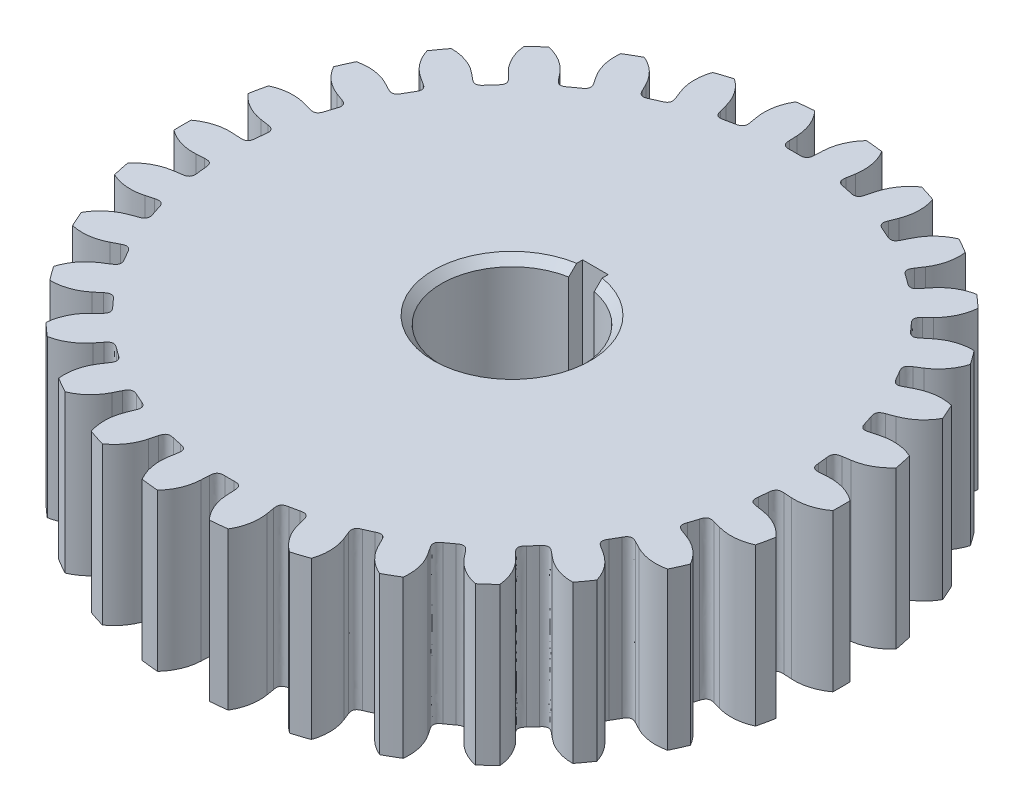
from build123d import *

# Parameters (mm, degrees)
BOSS_EXTRUDE1_DEPTH = 10
CIRPATTERN3_COUNT   = 30
CUT_EXTRUDE3_DEPTH  = 63.58706845
CHAMFER1_SIZE       = 1


with BuildPart() as part:
    # Sketch5 → Boss-Extrude1 (new, symmetric)
    with BuildSketch(Plane(origin=(0, 0, 0), x_dir=(1, 0, 0), z_dir=(0, 1, 0))):
        with BuildLine():
            Line((0, 0), (35.802788233, 3.763024678))
            ThreePointArc((35.802788233, 3.763024678), (35.87635809, 2.98109547), (35.932852743, 2.197747423))
            Line((35.932852743, 2.197747423), (37.92912234, 2.319844502))
            ThreePointArc((37.92912234, 2.319844502), (40.066301936, 2.071729703), (41.985607649, 1.099431829))
            ThreePointArc((41.985607649, 1.099431829), (42, 0), (41.985607649, -1.099431829))
            ThreePointArc((41.985607649, -1.099431829), (40.066301936, -2.071729703), (37.92912234, -2.319844502))
            Line((37.92912234, -2.319844502), (35.932852743, -2.197747423))
            ThreePointArc((35.932852743, -2.197747423), (35.87635809, -2.98109547), (35.802788233, -3.763024678))
            Line((35.802788233, -3.763024678), (0, 0))
        make_face()
    boss_extrude1 = extrude(amount=BOSS_EXTRUDE1_DEPTH, both=True)

    # Fillet3
    # a fillet whose section is not a circle: 1 mm, written as the material it adds along each edge
    with BuildSketch(Plane(origin=(35.932852743, 10, -2.197747423), x_dir=(0.9981347984218669, 0, -0.06104853953485661), z_dir=(0, -1, 0)), Plane(origin=(35.932852743, -10, 2.197747423), x_dir=(0.998134798421867, 0, 0.061048539534856595), z_dir=(0, 1, 0))) as fillet3_piece_1:
        with BuildLine():
            add(Edge.make_bspline([(0.986484018, 0), (0.822062706, 0), (0.657641394, 0), (0.294804365, -0.06865127), (0.074169551, -0.283401428), (-0.004263047, -0.644250474), (-0.008706866, -0.808611724), (-0.013150685, -0.972972973)], knots=[0, 0, 0, 0, 0, 0, 0.5, 0.5, 1, 1, 1, 1, 1, 1], degree=5))
            ThreePointArc((-0.013150685, -0.972972973), (-0.003287821, -0.486530921), (0, 0))
            Line((0, 0), (0.986484018, 0))
        make_face()
    extrude(amount=20)

    # CirPattern3: Boss-Extrude1 ×30 about axis
    cirpattern3_axis = Axis((0, 10, 0), (0, -1, 0))
    for i in range(1, CIRPATTERN3_COUNT):
        add(boss_extrude1.rotate(cirpattern3_axis, i * 360 / CIRPATTERN3_COUNT))

    # Fillet3 of CirPattern3
    # a fillet whose section is not a circle: 1 mm, written as the material it adds along each edge
    with BuildSketch(Plane(origin=(35.604571081, 10, 5.321138801), x_dir=(0.13442961197931483, 0, -0.9909231450637789), z_dir=(0, -1, 0)), Plane(origin=(33.720198813, 10, 12.607465725), x_dir=(0.3375165089858118, 0, -0.941319608933135), z_dir=(0, -1, 0)), Plane(origin=(30.362092049, 10, 19.3427859), x_dir=(0.5258523149657179, 0, -0.8505758889394852), z_dir=(0, -1, 0)), Plane(origin=(25.67701617, 10, 25.232733515), x_dir=(0.6912058514622661, 0, -0.7226579210832216), z_dir=(0, -1, 0)), Plane(origin=(19.869731471, 10, 30.019889594), x_dir=(0.8263503754762392, 0, -0.5631563343781889), z_dir=(0, -1, 0)), Plane(origin=(13.194044162, 10, 33.495032447), x_dir=(0.9253794228128641, 0, -0.3790421135369137), z_dir=(0, -1, 0)), Plane(origin=(5.941713811, 10, 35.506281655), x_dir=(0.9839649489094336, 0, -0.17836193348821816), z_dir=(0, -1, 0)), Plane(origin=(-1.570297945, 10, 35.965735977), x_dir=(0.999546485150984, 0, 0.030113518929438858), z_dir=(0, -1, 0)), Plane(origin=(-9.013680146, 10, 34.853315054), x_dir=(0.9714430436352546, 0, 0.237272866069159), z_dir=(0, -1, 0)), Plane(origin=(-16.063121272, 10, 32.217637018), x_dir=(0.9008828796117487, 0, 0.43406225040015106), z_dir=(0, -1, 0)), Plane(origin=(-22.410526919, 10, 28.173893647), x_dir=(0.790949810833542, 0, 0.6118810315268681), z_dir=(0, -1, 0)), Plane(origin=(-27.778485002, 10, 22.89881593), x_dir=(0.6464484399236214, 0, 0.76295767544492), z_dir=(0, -1, 0)), Plane(origin=(-31.932389994, 10, 16.622950076), x_dir=(0.47369417018526017, 0, 0.8806894078689137), z_dir=(0, -1, 0)), Plane(origin=(-34.690696316, 10, 9.620581539), x_dir=(0.28023719217299753, 0, 0.9599307871523834), z_dir=(0, -1, 0)), Plane(origin=(-35.932852743, 10, 2.197747423), x_dir=(0.07453250413551762, 0, 0.9972185847783269), z_dir=(0, -1, 0)), Plane(origin=(-35.604571081, 10, -5.321138801), x_dir=(-0.1344296119793113, 0, 0.9909231450637793), z_dir=(0, -1, 0)), Plane(origin=(-33.720198813, 10, -12.607465725), x_dir=(-0.3375165089858262, 0, 0.9413196089331299), z_dir=(0, -1, 0)), Plane(origin=(-30.362092049, 10, -19.3427859), x_dir=(-0.5258523149657195, 0, 0.8505758889394842), z_dir=(0, -1, 0)), Plane(origin=(-25.67701617, 10, -25.232733515), x_dir=(-0.6912058514622605, 0, 0.7226579210832269), z_dir=(0, -1, 0)), Plane(origin=(-19.869731471, 10, -30.019889594), x_dir=(-0.8263503754762364, 0, 0.563156334378193), z_dir=(0, -1, 0)), Plane(origin=(-13.194044162, 10, -33.495032447), x_dir=(-0.9253794228128651, 0, 0.3790421135369113), z_dir=(0, -1, 0)), Plane(origin=(-5.941713811, 10, -35.506281655), x_dir=(-0.9839649489094324, 0, 0.17836193348822474), z_dir=(0, -1, 0)), Plane(origin=(1.570297945, 10, -35.965735977), x_dir=(-0.9995464851509842, 0, -0.030113518929431548), z_dir=(0, -1, 0)), Plane(origin=(9.013680146, 10, -34.853315054), x_dir=(-0.9714430436352549, 0, -0.23727286606915732), z_dir=(0, -1, 0)), Plane(origin=(16.063121272, 10, -32.217637018), x_dir=(-0.900882879611752, 0, -0.43406225040014446), z_dir=(0, -1, 0)), Plane(origin=(22.410526919, 10, -28.173893647), x_dir=(-0.7909498108335425, 0, -0.6118810315268675), z_dir=(0, -1, 0)), Plane(origin=(27.778485002, 10, -22.89881593), x_dir=(-0.6464484399236218, 0, -0.7629576754449198), z_dir=(0, -1, 0)), Plane(origin=(31.932389994, 10, -16.622950076), x_dir=(-0.4736941701852644, 0, -0.8806894078689115), z_dir=(0, -1, 0)), Plane(origin=(34.690696316, 10, -9.620581539), x_dir=(-0.2802371921729893, 0, -0.9599307871523859), z_dir=(0, -1, 0))) as fillet3_of_cirpattern3_piece_1:
        with BuildLine():
            add(Edge.make_bspline([(0.973061841, 0), (0.808655546, 0.002222113), (0.64424925, 0.004444225), (0.282373163, 0.077992876), (0.064660793, 0.295705245), (-0.008887858, 0.657581333), (-0.01110997, 0.821987628), (-0.013332083, 0.986393924)], knots=[0, 0, 0, 0, 0, 0, 0.5, 0.5, 1, 1, 1, 1, 1, 1], degree=5))
            Line((-0.013332083, 0.986393924), (0, 0))
            ThreePointArc((0, 0), (0.486530921, 0.003287821), (0.973061841, 0))
        make_face()
    extrude(amount=20)
    with BuildSketch(Plane(origin=(34.690696316, -10, 9.620581539), x_dir=(0.9636304532086233, 0, 0.26723837607825607), z_dir=(0, 1, 0)), Plane(origin=(31.932389994, -10, 16.622950076), x_dir=(0.8870108331782218, 0, 0.4617486132350335), z_dir=(0, 1, 0)), Plane(origin=(27.778485002, -10, 22.89881593), x_dir=(0.7716245833877204, 0, 0.6360782202777634), z_dir=(0, 1, 0)), Plane(origin=(22.410526919, -10, 28.173893647), x_dir=(0.622514636637622, 0, 0.782608156852412), z_dir=(0, 1, 0)), Plane(origin=(16.063121272, -10, 32.217637018), x_dir=(0.4461978131098116, 0, 0.8949343616020237), z_dir=(0, 1, 0)), Plane(origin=(9.013680146, -10, 34.853315054), x_dir=(0.25038000405444055, 0, 0.968147640378108), z_dir=(0, 1, 0)), Plane(origin=(1.570297945, -10, 35.965735977), x_dir=(0.04361938736533595, 0, 0.9990482215818578), z_dir=(0, 1, 0)), Plane(origin=(-5.941713811, -10, 35.506281655), x_dir=(-0.1650476058606768, 0, 0.9862856015372315), z_dir=(0, 1, 0)), Plane(origin=(-13.194044162, -10, 33.495032447), x_dir=(-0.36650122672429636, 0, 0.9304175679820249), z_dir=(0, 1, 0)), Plane(origin=(-19.869731471, -10, 30.019889594), x_dir=(-0.551936985312057, 0, 0.8338858220671689), z_dir=(0, 1, 0)), Plane(origin=(-25.67701617, -10, 25.232733515), x_dir=(-0.7132504491541812, 0, 0.7009092642998512), z_dir=(0, 1, 0)), Plane(origin=(-30.362092049, -10, 19.3427859), x_dir=(-0.8433914458128878, 0, 0.5372996083468207), z_dir=(0, 1, 0)), Plane(origin=(-33.720198813, -10, 12.607465725), x_dir=(-0.9366721892483983, 0, 0.3502073812594656), z_dir=(0, 1, 0)), Plane(origin=(-35.604571081, -10, 5.321138801), x_dir=(-0.9890158633619168, 0, 0.14780941112961135), z_dir=(0, 1, 0)), Plane(origin=(-35.932852743, -10, -2.197747423), x_dir=(-0.9981347984218669, 0, -0.06104853953485703), z_dir=(0, 1, 0)), Plane(origin=(-34.690696316, -10, -9.620581539), x_dir=(-0.9636304532086231, 0, -0.2672383760782569), z_dir=(0, 1, 0)), Plane(origin=(-31.932389994, -10, -16.622950076), x_dir=(-0.8870108331782237, 0, -0.46174861323502997), z_dir=(0, 1, 0)), Plane(origin=(-27.778485002, -10, -22.89881593), x_dir=(-0.7716245833877183, 0, -0.636078220277766), z_dir=(0, 1, 0)), Plane(origin=(-22.410526919, -10, -28.173893647), x_dir=(-0.6225146366376192, 0, -0.7826081568524141), z_dir=(0, 1, 0)), Plane(origin=(-16.063121272, -10, -32.217637018), x_dir=(-0.44619781310981443, 0, -0.8949343616020221), z_dir=(0, 1, 0)), Plane(origin=(-9.013680146, -10, -34.853315054), x_dir=(-0.25038000405444055, 0, -0.968147640378108), z_dir=(0, 1, 0)), Plane(origin=(-1.570297945, -10, -35.965735977), x_dir=(-0.04361938736533604, 0, -0.9990482215818578), z_dir=(0, 1, 0)), Plane(origin=(5.941713811, -10, -35.506281655), x_dir=(0.1650476058606768, 0, -0.9862856015372315), z_dir=(0, 1, 0)), Plane(origin=(13.194044162, -10, -33.495032447), x_dir=(0.366501226724297, 0, -0.9304175679820247), z_dir=(0, 1, 0)), Plane(origin=(19.869731471, -10, -30.019889594), x_dir=(0.551936985312061, 0, -0.8338858220671663), z_dir=(0, 1, 0)), Plane(origin=(25.67701617, -10, -25.232733515), x_dir=(0.7132504491541795, 0, -0.7009092642998531), z_dir=(0, 1, 0)), Plane(origin=(30.362092049, -10, -19.3427859), x_dir=(0.8433914458128867, 0, -0.5372996083468223), z_dir=(0, 1, 0)), Plane(origin=(33.720198813, -10, -12.607465725), x_dir=(0.9366721892483983, 0, -0.3502073812594656), z_dir=(0, 1, 0)), Plane(origin=(35.604571081, -10, -5.321138801), x_dir=(0.9890158633619165, 0, -0.14780941112961246), z_dir=(0, 1, 0))) as fillet3_of_cirpattern3_piece_2:
        with BuildLine():
            add(Edge.make_bspline([(0.986484018, 0), (0.822062706, 0), (0.657641394, 0), (0.294804365, -0.06865127), (0.074169551, -0.283401428), (-0.004263047, -0.644250474), (-0.008706866, -0.808611724), (-0.013150685, -0.972972973)], knots=[0, 0, 0, 0, 0, 0, 0.5, 0.5, 1, 1, 1, 1, 1, 1], degree=5))
            ThreePointArc((-0.013150685, -0.972972973), (-0.003287821, -0.486530921), (0, 0))
            Line((0, 0), (0.986484018, 0))
        make_face()
    extrude(amount=20)

    # Sketch6 → Cut-Extrude3 (cut, through all)
    with BuildSketch(Plane(origin=(0, 10, 0), x_dir=(1, 0, 0), z_dir=(0, 1, 0))):
        with BuildLine():
            ThreePointArc((1.625, 8.852083088), (0, 9), (-1.625, 8.852083088))
            Line((-1.625, 8.852083088), (-1.625, 7.375))
            Line((-1.625, 7.375), (1.625, 7.375))
            Line((1.625, 7.375), (1.625, 8.852083088))
        make_face()
        with BuildLine():
            Line((-1.625, 7.375), (-1.625, 8.852083088))
            ThreePointArc((-1.625, 8.852083088), (-5.760859311, -6.914658343), (9, 0))
            ThreePointArc((9, 0), (6.914658343, 5.760859311), (1.625, 8.852083088))
            Line((1.625, 8.852083088), (1.625, 7.375))
            Line((1.625, 7.375), (-1.625, 7.375))
        make_face()
        with BuildLine():
            Line((1.625, 10.625), (-1.625, 10.625))
            Line((-1.625, 10.625), (-1.625, 8.852083088))
            ThreePointArc((-1.625, 8.852083088), (0, 9), (1.625, 8.852083088))
            Line((1.625, 8.852083088), (1.625, 10.625))
        make_face()
    extrude(amount=-CUT_EXTRUDE3_DEPTH, mode=Mode.SUBTRACT)

    # Chamfer1
    chamfer1_edges = [part.edges().sort_by_distance(p)[0] for p in [
        (-5.760859311, -10, 6.914658343),
        (-5.760859311, 10, 6.914658343),
    ]]
    chamfer(chamfer1_edges, length=CHAMFER1_SIZE)


solid = part.part
